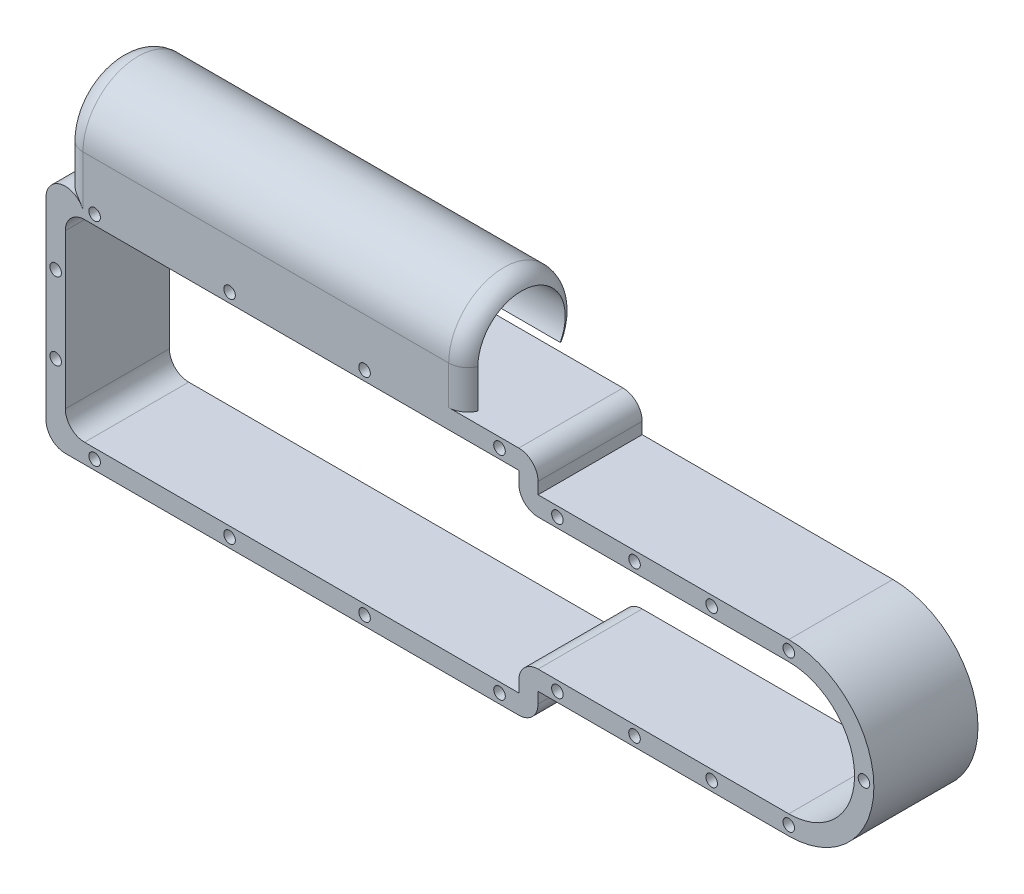
from build123d import *

# Parameters (mm, degrees)
SKETCH1_R            = 10.000000000000009
BOSS_EXTRUDE1_DEPTH  = 27
CUT_EXTRUDE3_DEPTH   = 157.18313390219527
SKETCH2_R            = 1.5000000000000042
CUT_EXTRUDE4_DEPTH   = 157.18313390219527
LPATTERN1_COUNT      = 4
LPATTERN1_PITCH      = 35
LPATTERN1_COUNT_DIR2 = 2
LPATTERN1_PITCH_DIR2 = 55
LPATTERN2_COUNT      = 2
LPATTERN2_PITCH      = 20
FILLET1_R            = 5
FILLET2_R            = 5
BOSS_EXTRUDE2_DEPTH  = 104
FILLET3_R            = 5
FILLET4_R            = 5
SKETCH13_R           = 1.4999999999999973
SKETCH13_R_2         = 1.4999999999999971
CUT_EXTRUDE8_DEPTH   = 163.89624264715565


with BuildPart() as part:
    # Sketch1 → Boss-Extrude1 (new body)
    # profile 1 of 2: a face of its own
    with BuildSketch(Plane.XY):
        with BuildLine():
            Line((128.8099999999999, 22), (63.80000000000001, 22))
            Line((63.800000000000026, 22), (63.800000000000026, -22.136002859999998))
            Line((63.80000000000001, -22.136002859999998), (128.8099999999999, -22.136002859999998))
            ThreePointArc((128.8099999999999, -22.136002859999998), (150.8780014299999, -0.06800142999999757), (128.8099999999999, 22))
        make_face()
        with Locations((128.81, 0)):
            Circle(SKETCH1_R, mode=Mode.SUBTRACT)
    # profile 2 of 2: a face of its own
    with BuildSketch(Plane.XY):
        with BuildLine():
            Line((-58.799999999999976, 29.999999999999993), (58.80000000000002, 29.999999999999993))
            ThreePointArc((58.80000000000002, 29.999999999999993), (62.33553390593276, 28.535533905932734), (63.800000000000026, 24.999999999999993))
            Line((63.800000000000026, 24.999999999999993), (63.800000000000026, -25))
            ThreePointArc((63.800000000000026, -25), (62.33553390593277, -28.53553390593274), (58.80000000000003, -30.000000000000004))
            Line((58.80000000000003, -30.000000000000004), (-58.79999999999999, -30.000000000000004))
            ThreePointArc((-58.79999999999999, -30.000000000000004), (-62.33553390593272, -28.535533905932734), (-63.79999999999998, -25))
            Line((-63.79999999999998, -25), (-63.79999999999998, 24.999999999999993))
            ThreePointArc((-63.79999999999998, 24.999999999999993), (-62.335533905932714, 28.53553390593273), (-58.799999999999976, 29.999999999999993))
        make_face()
    extrude(amount=BOSS_EXTRUDE1_DEPTH)

    # Sketch4 → Cut-Extrude3 (cut, through all)
    with BuildSketch(Plane.XY.offset(27)):
        with BuildLine():
            Line((128.8099999999999, 16.999999999999996), (58.800000000000026, 16.999999999999996))
            Line((58.800000000000026, 16.999999999999996), (58.800000000000026, 24.99999999999999))
            Line((58.800000000000026, 24.99999999999999), (-58.79999999999998, 24.99999999999999))
            Line((-58.79999999999998, 24.99999999999999), (-58.79999999999998, -25))
            Line((-58.79999999999998, -25), (58.800000000000026, -25))
            Line((58.800000000000026, -25), (58.800000000000026, -17.136002859999994))
            Line((58.800000000000026, -17.136002859999994), (128.8099999999999, -17.136002859999994))
            ThreePointArc((128.8099999999999, -17.136002859999994), (145.87800142999987, -0.06800142999999897), (128.8099999999999, 16.999999999999996))
        make_face()
    extrude(amount=-CUT_EXTRUDE3_DEPTH, mode=Mode.SUBTRACT)

    # Sketch2 → Cut-Extrude4 (cut, through all)
    with BuildSketch(Plane.XY.offset(27)):
        with Locations((-51.19999999999998, 27.49999999999999)):
            Circle(SKETCH2_R)
        with Locations((-61.29999999999998, 9.999999999999991)):
            Circle(SKETCH2_R)
    cut_extrude4 = extrude(amount=-CUT_EXTRUDE4_DEPTH, mode=Mode.SUBTRACT)

    # LPattern1: Cut-Extrude4 4 × 2
    with Locations(*[(i * LPATTERN1_PITCH, -j * LPATTERN1_PITCH_DIR2, 0) for i in range(LPATTERN1_COUNT) for j in range(LPATTERN1_COUNT_DIR2) if (i, j) != (0, 0)]):
        add(cut_extrude4, mode=Mode.SUBTRACT)

    # LPattern2: Cut-Extrude4 ×2
    with Locations(*[(0, -i * LPATTERN2_PITCH, 0) for i in range(1, LPATTERN2_COUNT)]):
        add(cut_extrude4, mode=Mode.SUBTRACT)

    # Fillet1
    fillet1_edges = [part.edges().sort_by_distance(p)[0] for p in [
        (58.800000000000026, -17.136002859999994, 13.5),
        (58.800000000000026, 16.999999999999996, 13.5),
    ]]
    fillet(fillet1_edges, radius=FILLET1_R)

    # Fillet2
    fillet2_edges = [part.edges().sort_by_distance(p)[0] for p in [
        (-58.79999999999998, -25, 13.5),
        (-58.79999999999998, 24.99999999999999, 13.5),
    ]]
    fillet(fillet2_edges, radius=FILLET2_R)

    # Sketch6 → Boss-Extrude2 (add)
    with BuildSketch(Plane.ZY.offset(58.79999999999998)):
        with BuildLine():
            Line((27, 29.999999999999993), (27, 39.99999999999999))
            ThreePointArc((27, 39.99999999999999), (9.251807345621204, 53.9041792903447), (0, 33.34381438418348))
            Line((0, 33.34381438418348), (2.6562431277765906, 34.738221945171176))
            ThreePointArc((2.6562431277765906, 34.738221945171176), (9.969884854205839, 50.99138601040448), (24, 39.99999999999999))
            Line((24, 39.99999999999999), (24, 29.999999999999993))
            Line((24, 29.999999999999993), (27, 29.999999999999993))
        make_face()
    extrude(amount=-BOSS_EXTRUDE2_DEPTH)

    # Fillet3
    # the kernel refuses this fillet: 5 mm, written as the material it takes off along each edge
    with BuildSketch(Plane(origin=(-58.79999999999998, 18.543560762610387, 27), x_dir=(1, 0, 0), z_dir=(0, 1, 0))) as fillet3_piece_1_section:
        with BuildLine():
            CenterArc((4.5825756949558425, 5), FILLET3_R, 203.57817847820183, 66.42182152179817)
            Line((0, 3), (0, 0))
            Line((0, 0), (4.5825756949558425, 0))
        make_face()
    fillet3_piece_1 = extrude(amount=21.456439237389606, mode=Mode.PRIVATE)
    fillet3_piece_1 = fillet3_piece_1 - Plane(origin=(-58.79999999999997, 24.99999999999998, 26.19166673293572), x_dir=(-1, 2.84e-15, 0), z_dir=(0, 0, -1)) * Cylinder(5.000000000000014, 62, mode=Mode.PRIVATE)
    add(fillet3_piece_1, mode=Mode.SUBTRACT)
    with BuildSketch(Plane(origin=(-58.79999999999998, 39.999999999999986, 12.679540611996243), x_dir=(0, 5e-16, 1), z_dir=(0, -1, 5e-16))) as fillet3_piece_2_section:
        with BuildLine():
            CenterArc((9.320459388003757, -4.5825756949558425), FILLET3_R, 0, 66.42182152179822)
            Line((14.320459388003757, -4.5825756949558425), (14.320459388003757, 0))
            Line((14.320459388003757, 0), (11.320459388003753, 0))
        make_face()
    fillet3_piece_2 = revolve(axis=Axis((-58.79999999999998, 39.999999999999986, 12.679540611996243), (-1, 0, 0)), revolution_arc=253.63253481622772, mode=Mode.PRIVATE)
    fillet3_piece_2 = split(fillet3_piece_2, bisect_by=Plane(origin=(-58.68295720401122, 29.999999999999993, 23.934406963840928), z_dir=(0, 1, 0)), keep=Keep.TOP, mode=Mode.PRIVATE)
    add(fillet3_piece_2, mode=Mode.SUBTRACT)

    # Fillet4
    # the kernel refuses this fillet: 5 mm, written as the material it takes off along each edge
    with BuildSketch(Plane(origin=(45.20000000000002, 29.999999999999993, 27), x_dir=(-1, 0, 0), z_dir=(0, 1, 0))) as fillet4_piece_1:
        with BuildLine():
            CenterArc((4.5825756949558425, -5), FILLET4_R, 90, 66.42182152179817)
            Line((0, -3), (0, 0))
            Line((0, 0), (4.5825756949558425, 0))
        make_face()
    extrude(amount=10, mode=Mode.SUBTRACT)
    with BuildSketch(Plane(origin=(45.20000000000002, 39.999999999999986, 12.679540611996243), x_dir=(0, 5e-16, 1), z_dir=(0, -1, 5e-16))) as fillet4_piece_2_section:
        with BuildLine():
            CenterArc((9.320459388003757, 4.582575694955835), FILLET4_R, 293.57817847820183, 66.42182152179817)
            Line((11.320459388003757, -7.11e-15), (14.320459388003757, 0))
            Line((14.320459388003757, 0), (14.320459388003757, 4.582575694955835))
        make_face()
    fillet4_piece_2 = revolve(axis=Axis((45.20000000000002, 39.999999999999986, 12.679540611996243), (-1, 0, 0)), revolution_arc=253.63253481622772, mode=Mode.PRIVATE)
    fillet4_piece_2 = split(fillet4_piece_2, bisect_by=Plane(origin=(43.36151431814506, 29.999999999999993, 25.79888399879933), z_dir=(0, 1, 0)), keep=Keep.TOP, mode=Mode.PRIVATE)
    add(fillet4_piece_2, mode=Mode.SUBTRACT)

    # Sketch13 → Cut-Extrude8 (cut, through all)
    with BuildSketch(Plane.XY.offset(27)):
        with Locations((68.8099999999999, 19.5)):
            Circle(SKETCH13_R)
        with Locations((88.8099999999999, 19.5)):
            Circle(SKETCH13_R)
        with Locations((108.8099999999999, 19.5)):
            Circle(SKETCH13_R)
        with Locations((128.8099999999999, 19.5)):
            Circle(SKETCH13_R)
        with Locations((88.8100000000003, -19.64)):
            Circle(SKETCH13_R)
        with Locations((108.81000000000031, -19.64)):
            Circle(SKETCH13_R)
        with Locations((128.81000000000031, -19.64)):
            Circle(SKETCH13_R)
        with Locations((68.8100000000003, -19.64)):
            Circle(SKETCH13_R)
        with Locations((148.3099999999999, 0)):
            Circle(SKETCH13_R_2)
    extrude(amount=-CUT_EXTRUDE8_DEPTH, mode=Mode.SUBTRACT)


solid = part.part
